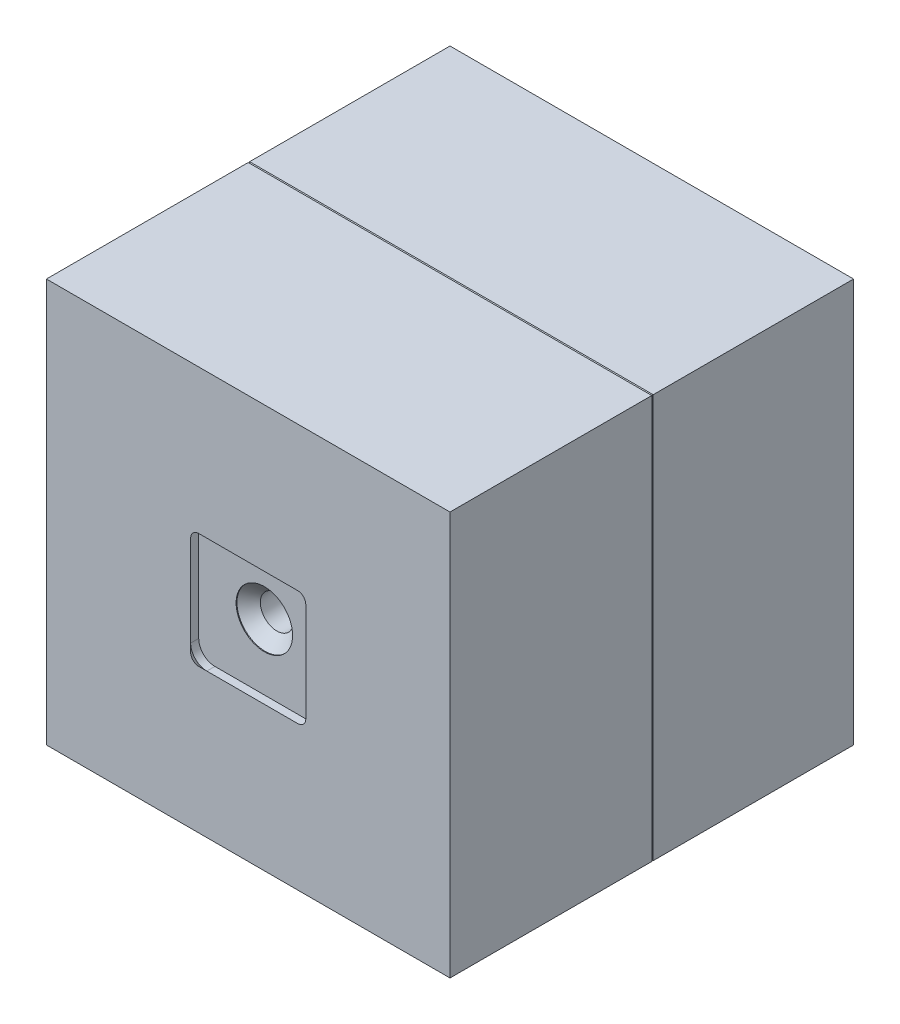
from build123d import *
from build123d.topology import SkipClean

# Parameters (mm, degrees)
SKETCH1_W            = 100
SKETCH1_H            = 100
BOSS_EXTRUDE1_DEPTH  = 50
SKETCH2_W            = 12.1
SKETCH2_H            = 12.1
CUT_EXTRUDE1_DEPTH   = 6.05
CAVITY1_START        = -48
CAVITY1_DEPTH        = 2
CAVITY1_START_2      = 46
CAVITY1_3_DEPTH      = 2
SKETCH5_R            = 2.5
CUT_EXTRUDE2_DEPTH   = 123.474487221
CHAMFER1_SIZE        = 0.35
SKETCH6_OUTSIDE_W    = 136.642
SKETCH6_OUTSIDE_H    = 136.642
CUT_EXTRUDE3_DEPTH   = 2
SKETCH7_OUTSIDE_W    = 136.642
SKETCH7_OUTSIDE_H    = 136.642
SKETCH7_OUTSIDE_W_2  = 96
SKETCH7_OUTSIDE_H_2  = 96
CUT_EXTRUDE4_DEPTH   = 121.847010801
SKETCH8_W            = 92
SKETCH8_H            = 92
SKETCH8_W_2          = 88
SKETCH8_H_2          = 88
CUT_EXTRUDE5_DEPTH   = 121.847010801
SKETCH9_R            = 1.5
CUT_EXTRUDE6_DEPTH   = 2
CIRPATTERN1_COUNT    = 4
SKETCH11_OUTSIDE_W   = 136.642
SKETCH11_OUTSIDE_H   = 136.642
SKETCH11_OUTSIDE_W_2 = 88
SKETCH11_OUTSIDE_H_2 = 88
CUT_EXTRUDE7_DEPTH   = 2
BOSS_EXTRUDE2_DEPTH  = 46
CIRPATTERN2_COUNT    = 4
FILLET1_R            = 1
FILLET2_START        = 2
FILLET2_DEPTH        = 46
SKETCH13_W           = 12.1
SKETCH13_H           = 12.1
SKETCH13_R           = 2.5
BOSS_EXTRUDE3_DEPTH  = 6.05
BOSS_EXTRUDE4_DEPTH  = 2
CUT_EXTRUDE10_DEPTH  = 2.5
CUT_SWEEP1_PITCH     = 2.5
CUT_SWEEP1_FROM      = 4
CHAMFER3_SIZE2       = 1.5
CHAMFER3_SIZE        = 2
CHAMFER4_SIZE2       = 1.81635632
CHAMFER4_SIZE        = 2.5
CUT_EXTRUDE11_DEPTH  = 44
CIRPATTERN3_COUNT    = 4
SKETCH22_R           = 4.1
CUT_EXTRUDE12_DEPTH  = 4.5
SKETCH24_W           = 100
SKETCH24_H           = 100
BOSS_EXTRUDE5_DEPTH  = 2
SKETCH25_W           = 100
SKETCH25_H           = 100
SKETCH25_W_2         = 88
SKETCH25_H_2         = 88
BOSS_EXTRUDE6_DEPTH  = 48


with BuildPart() as part:
    # Sketch1 → Boss-Extrude1 (new, symmetric)
    with BuildSketch(Plane.XY):
        Rectangle(SKETCH1_W, SKETCH1_H)
    extrude(amount=BOSS_EXTRUDE1_DEPTH, both=True)

    # Sketch2 → Cut-Extrude1 (cut, symmetric)
    with BuildSketch(Plane(origin=(0, 0, 0), x_dir=(1, 0, 0), z_dir=(0, 1, 0))):
        Rectangle(SKETCH2_W, SKETCH2_H)
    extrude(amount=CUT_EXTRUDE1_DEPTH, both=True, mode=Mode.SUBTRACT)


with BuildPart() as body_2:
    # Split1: read off the stored shape, not the designer's step
    # Split1: the piece on the far side of the plane
    add(part.part)
    split(bisect_by=Plane.XY, keep=Keep.BOTTOM)

    # Cavity1: read off the stored shape, not the designer's step
    # Cavity1 outline → Cavity1 (cut)
    with BuildSketch(Plane.XY.offset(CAVITY1_START)):
        with BuildLine():
            Line((16.263455967, -12.263455967), (16.263455967, 12.263455967))
            ThreePointArc((16.263455967, 12.263455967), (15.091883092, 15.091883092), (12.263455967, 16.263455967))
            Line((12.263455967, 16.263455967), (-12.263455967, 16.263455967))
            ThreePointArc((-12.263455967, 16.263455967), (-15.091883092, 15.091883092), (-16.263455967, 12.263455967))
            Line((-16.263455967, 12.263455967), (-16.263455967, -12.263455967))
            ThreePointArc((-16.263455967, -12.263455967), (-15.091883092, -15.091883092), (-12.263455967, -16.263455967))
            Line((-12.263455967, -16.263455967), (12.263455967, -16.263455967))
            ThreePointArc((12.263455967, -16.263455967), (15.091883092, -15.091883092), (16.263455967, -12.263455967))
        make_face()
    extrude(amount=CAVITY1_DEPTH, mode=Mode.SUBTRACT)

    # Cavity1 2: loft between two sections, ruled curve by curve
    cavity1_2_from = [
        Edge.make_three_point_arc((14.263455967, 12.263455967, -50), (13.67766953, 13.67766953, -50), (12.263455967, 14.263455967, -50)),
        Edge.make_three_point_arc((-12.263455967, 14.263455967, -50), (-13.67766953, 13.67766953, -50), (-14.263455967, 12.263455967, -50)),
        Edge.make_three_point_arc((12.263455967, -14.263455967, -50), (13.67766953, -13.67766953, -50), (14.263455967, -12.263455967, -50)),
        Edge.make_three_point_arc((-14.263455967, -12.263455967, -50), (-13.67766953, -13.67766953, -50), (-12.263455967, -14.263455967, -50)),
        Edge.make_line((-12.263455967, 14.263455967, -50), (12.263455967, 14.263455967, -50)),
        Edge.make_line((14.263455967, 12.263455967, -50), (14.263455967, -12.263455967, -50)),
        Edge.make_line((-14.263455967, 12.263455967, -50), (-14.263455967, -12.263455967, -50)),
        Edge.make_line((12.263455967, -14.263455967, -50), (-12.263455967, -14.263455967, -50)),
    ]
    cavity1_2_to = [
        Edge.make_three_point_arc((16.263455967, 12.263455967, -48), (15.091883092, 15.091883092, -48), (12.263455967, 16.263455967, -48)),
        Edge.make_three_point_arc((-12.263455967, 16.263455967, -48), (-15.091883092, 15.091883092, -48), (-16.263455967, 12.263455967, -48)),
        Edge.make_three_point_arc((12.263455967, -16.263455967, -48), (15.091883092, -15.091883092, -48), (16.263455967, -12.263455967, -48)),
        Edge.make_three_point_arc((-16.263455967, -12.263455967, -48), (-15.091883092, -15.091883092, -48), (-12.263455967, -16.263455967, -48)),
        Edge.make_line((-12.263455967, 16.263455967, -48), (12.263455967, 16.263455967, -48)),
        Edge.make_line((16.263455967, 12.263455967, -48), (16.263455967, -12.263455967, -48)),
        Edge.make_line((-16.263455967, 12.263455967, -48), (-16.263455967, -12.263455967, -48)),
        Edge.make_line((12.263455967, -16.263455967, -48), (-12.263455967, -16.263455967, -48)),
    ]
    cavity1_2 = Solid(Shell([*[Face.make_surface_from_curves(cavity1_2_from[k], cavity1_2_to[k]) for k in range(8)], Face(Wire(cavity1_2_from)), Face(Wire(cavity1_2_to))]))
    add(cavity1_2, mode=Mode.SUBTRACT)


with BuildPart() as part_1:
    add(part.part)

    # Split1
    split(bisect_by=Plane.XY, keep=Keep.TOP)

    # Cavity1 3 outline → Cavity1 3 (cut)
    with BuildSketch(Plane.XY.offset(CAVITY1_START_2)):
        with BuildLine():
            Line((-16.263455967, 12.263455967), (-16.263455967, -12.263455967))
            ThreePointArc((-16.263455967, -12.263455967), (-15.091883092, -15.091883092), (-12.263455967, -16.263455967))
            Line((-12.263455967, -16.263455967), (12.263455967, -16.263455967))
            ThreePointArc((12.263455967, -16.263455967), (15.091883092, -15.091883092), (16.263455967, -12.263455967))
            Line((16.263455967, -12.263455967), (16.263455967, 12.263455967))
            ThreePointArc((16.263455967, 12.263455967), (15.091883092, 15.091883092), (12.263455967, 16.263455967))
            Line((12.263455967, 16.263455967), (-12.263455967, 16.263455967))
            ThreePointArc((-12.263455967, 16.263455967), (-15.091883092, 15.091883092), (-16.263455967, 12.263455967))
        make_face()
    extrude(amount=CAVITY1_3_DEPTH, mode=Mode.SUBTRACT)

    # Cavity1 4: loft between two sections, ruled curve by curve
    cavity1_4_from = [
        Edge.make_three_point_arc((-14.263455967, 12.263455967, 50), (-13.67766953, 13.67766953, 50), (-12.263455967, 14.263455967, 50)),
        Edge.make_three_point_arc((12.263455967, 14.263455967, 50), (13.67766953, 13.67766953, 50), (14.263455967, 12.263455967, 50)),
        Edge.make_three_point_arc((-12.263455967, -14.263455967, 50), (-13.67766953, -13.67766953, 50), (-14.263455967, -12.263455967, 50)),
        Edge.make_three_point_arc((14.263455967, -12.263455967, 50), (13.67766953, -13.67766953, 50), (12.263455967, -14.263455967, 50)),
        Edge.make_line((12.263455967, 14.263455967, 50), (-12.263455967, 14.263455967, 50)),
        Edge.make_line((-14.263455967, 12.263455967, 50), (-14.263455967, -12.263455967, 50)),
        Edge.make_line((14.263455967, 12.263455967, 50), (14.263455967, -12.263455967, 50)),
        Edge.make_line((-12.263455967, -14.263455967, 50), (12.263455967, -14.263455967, 50)),
    ]
    cavity1_4_to = [
        Edge.make_three_point_arc((-16.263455967, 12.263455967, 48), (-15.091883092, 15.091883092, 48), (-12.263455967, 16.263455967, 48)),
        Edge.make_three_point_arc((12.263455967, 16.263455967, 48), (15.091883092, 15.091883092, 48), (16.263455967, 12.263455967, 48)),
        Edge.make_three_point_arc((-12.263455967, -16.263455967, 48), (-15.091883092, -15.091883092, 48), (-16.263455967, -12.263455967, 48)),
        Edge.make_three_point_arc((16.263455967, -12.263455967, 48), (15.091883092, -15.091883092, 48), (12.263455967, -16.263455967, 48)),
        Edge.make_line((12.263455967, 16.263455967, 48), (-12.263455967, 16.263455967, 48)),
        Edge.make_line((-16.263455967, 12.263455967, 48), (-16.263455967, -12.263455967, 48)),
        Edge.make_line((16.263455967, 12.263455967, 48), (16.263455967, -12.263455967, 48)),
        Edge.make_line((-12.263455967, -16.263455967, 48), (12.263455967, -16.263455967, 48)),
    ]
    cavity1_4 = Solid(Shell([*[Face.make_surface_from_curves(cavity1_4_from[k], cavity1_4_to[k]) for k in range(8)], Face(Wire(cavity1_4_from)), Face(Wire(cavity1_4_to))]))
    add(cavity1_4, mode=Mode.SUBTRACT)


with BuildPart() as cut_extrude2_tool:
    # Sketch5 → Cut-Extrude2 (new, through all)
    with BuildSketch(Plane.XY.offset(50)):
        with Locations(Location((0, 0, 0), (0, 0, 180))):
            Circle(SKETCH5_R)
    extrude(amount=-CUT_EXTRUDE2_DEPTH)


with BuildPart() as part_2:
    add(part_1.part)

    # Cut-Extrude2: cut by cut_extrude2_tool
    add(cut_extrude2_tool.part, mode=Mode.SUBTRACT)

    # Sketch6 outside → Cut-Extrude3 (cut)
    with BuildSketch(Plane.XY.offset(50)):
        Rectangle(SKETCH6_OUTSIDE_W, SKETCH6_OUTSIDE_H)
        with BuildLine():
            Line((-12.263455967, -18.263455967), (12.263455967, -18.263455967))
            ThreePointArc((12.263455967, -18.263455967), (16.506096654, -16.506096654), (18.263455967, -12.263455967))
            Line((18.263455967, -12.263455967), (18.263455967, 12.263455967))
            ThreePointArc((18.263455967, 12.263455967), (16.506096654, 16.506096654), (12.263455967, 18.263455967))
            Line((12.263455967, 18.263455967), (-12.263455967, 18.263455967))
            ThreePointArc((-12.263455967, 18.263455967), (-16.506096654, 16.506096654), (-18.263455967, 12.263455967))
            Line((-18.263455967, 12.263455967), (-18.263455967, -12.263455967))
            ThreePointArc((-18.263455967, -12.263455967), (-16.506096654, -16.506096654), (-12.263455967, -18.263455967))
        make_face(mode=Mode.SUBTRACT)
    extrude(amount=-CUT_EXTRUDE3_DEPTH, mode=Mode.SUBTRACT)

    # Sketch7 outside → Cut-Extrude4 (cut, through all)
    with BuildSketch(Plane.XY.offset(48)):
        Rectangle(SKETCH7_OUTSIDE_W, SKETCH7_OUTSIDE_H)
        Rectangle(SKETCH7_OUTSIDE_W_2, SKETCH7_OUTSIDE_H_2, mode=Mode.SUBTRACT)
    extrude(amount=-CUT_EXTRUDE4_DEPTH, mode=Mode.SUBTRACT)

    # Sketch8 → Cut-Extrude5 (cut, through all)
    with BuildSketch(Plane.XY.offset(48)):
        Rectangle(SKETCH8_W, SKETCH8_H)
        Rectangle(SKETCH8_W_2, SKETCH8_H_2, mode=Mode.SUBTRACT)
    extrude(amount=-CUT_EXTRUDE5_DEPTH, mode=Mode.SUBTRACT)


with BuildPart() as body_2_1:
    add(body_2.part)

    # Cut-Extrude2: cut by cut_extrude2_tool
    add(cut_extrude2_tool.part, mode=Mode.SUBTRACT)

    # Chamfer1
    chamfer1_edges = [body_2_1.edges().sort_by_distance(p)[0] for p in [
        (-50, 0, 0),
        (0, -50, 0),
        (50, 0, 0),
        (0, 50, 0),
    ]]
    chamfer(chamfer1_edges, length=CHAMFER1_SIZE)


with BuildPart() as cut_extrude5_piece_1:
    # of the separate pieces the step leaves, piece 1, a body of its own (cut_extrude5_pieces)
    add(part_2.part.solids().sort_by_distance((-44, -44, 48))[0])



with BuildPart() as cut_extrude5_piece_2:
    # of the separate pieces the step leaves, piece 2, a body of its own (cut_extrude5_pieces)
    add(part_2.part.solids().sort_by_distance((48, 48, 48))[0])

    # Sketch9 → Cut-Extrude6 (cut)
    with BuildSketch(Plane(origin=(0, 48, 0), x_dir=(1, 0, 0), z_dir=(0, 1, 0))):
        with Locations(Location((-42.5, -44.5, 0), (0, 0, 180))):
            Circle(SKETCH9_R)
        with Locations(Location((-42.5, -39.5, 0), (0, 0, 180))):
            Circle(SKETCH9_R)
        with Locations(Location((-42.5, -34.5, 0), (0, 0, 180))):
            Circle(SKETCH9_R)
        with Locations(Location((-42.5, -29.5, 0), (0, 0, 180))):
            Circle(SKETCH9_R)
        with Locations(Location((-37.5, -44.5, 0), (0, 0, 180))):
            Circle(SKETCH9_R)
        with Locations(Location((-37.5, -39.5, 0), (0, 0, 180))):
            Circle(SKETCH9_R)
        with Locations(Location((-37.5, -34.5, 0), (0, 0, 180))):
            Circle(SKETCH9_R)
        with Locations(Location((-37.5, -29.5, 0), (0, 0, 180))):
            Circle(SKETCH9_R)
        with Locations(Location((-32.5, -44.5, 0), (0, 0, 180))):
            Circle(SKETCH9_R)
        with Locations(Location((-32.5, -39.5, 0), (0, 0, 180))):
            Circle(SKETCH9_R)
        with Locations(Location((-32.5, -34.5, 0), (0, 0, 180))):
            Circle(SKETCH9_R)
        with Locations(Location((-32.5, -29.5, 0), (0, 0, 180))):
            Circle(SKETCH9_R)
        with Locations(Location((-27.5, -44.5, 0), (0, 0, 180))):
            Circle(SKETCH9_R)
        with Locations(Location((-27.5, -39.5, 0), (0, 0, 180))):
            Circle(SKETCH9_R)
        with Locations(Location((-27.5, -34.5, 0), (0, 0, 180))):
            Circle(SKETCH9_R)
        with Locations(Location((-27.5, -29.5, 0), (0, 0, 180))):
            Circle(SKETCH9_R)
        with Locations(Location((-22.5, -44.5, 0), (0, 0, 180))):
            Circle(SKETCH9_R)
        with Locations(Location((-22.5, -39.5, 0), (0, 0, 180))):
            Circle(SKETCH9_R)
        with Locations(Location((-22.5, -34.5, 0), (0, 0, 180))):
            Circle(SKETCH9_R)
        with Locations(Location((-22.5, -29.5, 0), (0, 0, 180))):
            Circle(SKETCH9_R)
        with Locations(Location((-17.5, -44.5, 0), (0, 0, 180))):
            Circle(SKETCH9_R)
        with Locations(Location((-17.5, -39.5, 0), (0, 0, 180))):
            Circle(SKETCH9_R)
        with Locations(Location((-17.5, -34.5, 0), (0, 0, 180))):
            Circle(SKETCH9_R)
        with Locations(Location((-17.5, -29.5, 0), (0, 0, 180))):
            Circle(SKETCH9_R)
        with Locations(Location((-12.5, -44.5, 0), (0, 0, 180))):
            Circle(SKETCH9_R)
        with Locations(Location((-12.5, -39.5, 0), (0, 0, 180))):
            Circle(SKETCH9_R)
        with Locations(Location((-12.5, -34.5, 0), (0, 0, 180))):
            Circle(SKETCH9_R)
        with Locations(Location((-12.5, -29.5, 0), (0, 0, 180))):
            Circle(SKETCH9_R)
        with Locations(Location((-7.5, -44.5, 0), (0, 0, 180))):
            Circle(SKETCH9_R)
        with Locations(Location((-7.5, -39.5, 0), (0, 0, 180))):
            Circle(SKETCH9_R)
        with Locations(Location((-7.5, -34.5, 0), (0, 0, 180))):
            Circle(SKETCH9_R)
        with Locations(Location((-7.5, -29.5, 0), (0, 0, 180))):
            Circle(SKETCH9_R)
    cut_extrude6 = extrude(amount=-CUT_EXTRUDE6_DEPTH, mode=Mode.SUBTRACT)

    # CirPattern1: Cut-Extrude6 ×4 about axis
    cirpattern1_axis = Axis((0, 0, -50), (0, 0, 1))
    for i in range(1, CIRPATTERN1_COUNT):
        add(cut_extrude6.rotate(cirpattern1_axis, i * 360 / CIRPATTERN1_COUNT), mode=Mode.SUBTRACT)

    # Sketch11 outside → Cut-Extrude7 (cut)
    with BuildSketch(Plane(origin=(0, 0, 0), x_dir=(-1, 0, 0), z_dir=(0, 0, -1))):
        Rectangle(SKETCH11_OUTSIDE_W, SKETCH11_OUTSIDE_H)
        Rectangle(SKETCH11_OUTSIDE_W_2, SKETCH11_OUTSIDE_H_2, mode=Mode.SUBTRACT)
    extrude(amount=-CUT_EXTRUDE7_DEPTH, mode=Mode.SUBTRACT)


with BuildPart() as cut_extrude5_piece_1_1:
    add(cut_extrude5_piece_1.part)

    add(cut_extrude5_piece_2.part)  # Boss-Extrude2 merges Cut-Extrude5 piece 2
    # Sketch10 → Boss-Extrude2 (add)
    with BuildSketch(Plane.XY.offset(48)):
        Polygon((42.232233047, 44), (45.767766953, 47.535533906), (47.535533906, 45.767766953), (44, 42.232233047), align=None)
    boss_extrude2 = extrude(amount=-BOSS_EXTRUDE2_DEPTH)

    # CirPattern2: Boss-Extrude2 ×4 about axis
    cirpattern2_axis = Axis((0, 0, 0), (0, 0, 1))
    for i in range(1, CIRPATTERN2_COUNT):
        add(boss_extrude2.rotate(cirpattern2_axis, i * 360 / CIRPATTERN2_COUNT))

    # Fillet1
    # the kernel refuses this fillet: 1 mm, written as the material it adds along each edge
    with BuildSketch(Plane(origin=(-44.232233047, 46, 2), x_dir=(1, 0, 0), z_dir=(0, 0, 1))) as fillet1_piece_1_section:
        with BuildLine():
            CenterArc((FILLET1_R * 2.41421356237, -FILLET1_R), FILLET1_R, 90, 135)
            Line((FILLET1_R * 1.70710678119, -FILLET1_R * 1.70710678119), (0, 0))
            Line((0, 0), (FILLET1_R * 2.41421356237, 0))
        make_face()
    fillet1_piece_1 = extrude(amount=46, mode=Mode.PRIVATE)
    fillet1_piece_1 = fillet1_piece_1 - Plane(origin=(-42.5, 46, 29.5), x_dir=(-1, 0, 0), z_dir=(0, 1, 0)) * Cylinder(1.5, 102, mode=Mode.PRIVATE)
    fillet1_piece_1 = fillet1_piece_1 - Plane(origin=(-42.5, 46, 34.5), x_dir=(-1, 0, 0), z_dir=(0, 1, 0)) * Cylinder(1.5, 102, mode=Mode.PRIVATE)
    fillet1_piece_1 = fillet1_piece_1 - Plane(origin=(-42.5, 46, 39.5), x_dir=(-1, 0, 0), z_dir=(0, 1, 0)) * Cylinder(1.5, 102, mode=Mode.PRIVATE)
    fillet1_piece_1 = fillet1_piece_1 - Plane(origin=(-42.5, 46, 44.5), x_dir=(-1, 0, 0), z_dir=(0, 1, 0)) * Cylinder(1.5, 102, mode=Mode.PRIVATE)
    add(fillet1_piece_1)
    with BuildSketch(Plane(origin=(-46, 44.232233047, 48), x_dir=(0, -1, 0), z_dir=(0, 0, -1)), Plane(origin=(-44.232233047, -46, 48), x_dir=(1, 0, 0), z_dir=(0, 0, -1)), Plane(origin=(46, -44.232233047, 48), x_dir=(0, 1, 0), z_dir=(0, 0, -1)), Plane(origin=(44.232233047, 46, 48), x_dir=(-1, 0, 0), z_dir=(0, 0, -1))) as fillet1_piece_2:
        with BuildLine():
            CenterArc((FILLET1_R * 2.41421356237, -FILLET1_R), FILLET1_R, 90, 135)
            Line((FILLET1_R * 1.70710678119, -FILLET1_R * 1.70710678119), (0, 0))
            Line((0, 0), (FILLET1_R * 2.41421356237, 0))
        make_face()
    extrude(amount=46)
    with BuildSketch(Plane(origin=(-46, -44.232233047, 2), x_dir=(0, 1, 0), z_dir=(0, 0, 1))) as fillet1_piece_3_section:
        with BuildLine():
            CenterArc((FILLET1_R * 2.41421356237, -FILLET1_R), FILLET1_R, 90, 135)
            Line((FILLET1_R * 1.70710678119, -FILLET1_R * 1.70710678119), (0, 0))
            Line((0, 0), (FILLET1_R * 2.41421356237, 0))
        make_face()
    fillet1_piece_3 = extrude(amount=46, mode=Mode.PRIVATE)
    fillet1_piece_3 = fillet1_piece_3 - Plane(origin=(-46, -42.5, 29.5), x_dir=(0, -1, 0), z_dir=(-1, 0, 0)) * Cylinder(1.5, 102, mode=Mode.PRIVATE)
    fillet1_piece_3 = fillet1_piece_3 - Plane(origin=(-46, -42.5, 34.5), x_dir=(0, -1, 0), z_dir=(-1, 0, 0)) * Cylinder(1.5, 102, mode=Mode.PRIVATE)
    fillet1_piece_3 = fillet1_piece_3 - Plane(origin=(-46, -42.5, 39.5), x_dir=(0, -1, 0), z_dir=(-1, 0, 0)) * Cylinder(1.5, 102, mode=Mode.PRIVATE)
    fillet1_piece_3 = fillet1_piece_3 - Plane(origin=(-46, -42.5, 44.5), x_dir=(0, -1, 0), z_dir=(-1, 0, 0)) * Cylinder(1.5, 102, mode=Mode.PRIVATE)
    add(fillet1_piece_3)
    with BuildSketch(Plane(origin=(44.232233047, -46, 2), x_dir=(-1, 0, 0), z_dir=(0, 0, 1))) as fillet1_piece_4_section:
        with BuildLine():
            CenterArc((FILLET1_R * 2.41421356237, -FILLET1_R), FILLET1_R, 90, 135)
            Line((FILLET1_R * 1.70710678119, -FILLET1_R * 1.70710678119), (0, 0))
            Line((0, 0), (FILLET1_R * 2.41421356237, 0))
        make_face()
    fillet1_piece_4 = extrude(amount=46, mode=Mode.PRIVATE)
    fillet1_piece_4 = fillet1_piece_4 - Plane(origin=(42.5, -46, 29.5), x_dir=(1, 0, 0), z_dir=(0, -1, 0)) * Cylinder(1.5, 102, mode=Mode.PRIVATE)
    fillet1_piece_4 = fillet1_piece_4 - Plane(origin=(42.5, -46, 34.5), x_dir=(1, 0, 0), z_dir=(0, -1, 0)) * Cylinder(1.5, 102, mode=Mode.PRIVATE)
    fillet1_piece_4 = fillet1_piece_4 - Plane(origin=(42.5, -46, 39.5), x_dir=(1, 0, 0), z_dir=(0, -1, 0)) * Cylinder(1.5, 102, mode=Mode.PRIVATE)
    fillet1_piece_4 = fillet1_piece_4 - Plane(origin=(42.5, -46, 44.5), x_dir=(1, 0, 0), z_dir=(0, -1, 0)) * Cylinder(1.5, 102, mode=Mode.PRIVATE)
    add(fillet1_piece_4)
    with BuildSketch(Plane(origin=(46, 44.232233047, 2), x_dir=(0, -1, 0), z_dir=(0, 0, 1))) as fillet1_piece_5_section:
        with BuildLine():
            CenterArc((FILLET1_R * 2.41421356237, -FILLET1_R), FILLET1_R, 90, 135)
            Line((FILLET1_R * 1.70710678119, -FILLET1_R * 1.70710678119), (0, 0))
            Line((0, 0), (FILLET1_R * 2.41421356237, 0))
        make_face()
    fillet1_piece_5 = extrude(amount=46, mode=Mode.PRIVATE)
    fillet1_piece_5 = fillet1_piece_5 - Plane(origin=(46, 42.5, 29.5), x_dir=(0, 1, 0), z_dir=(1, 0, 0)) * Cylinder(1.5, 102, mode=Mode.PRIVATE)
    fillet1_piece_5 = fillet1_piece_5 - Plane(origin=(46, 42.5, 34.5), x_dir=(0, 1, 0), z_dir=(1, 0, 0)) * Cylinder(1.5, 102, mode=Mode.PRIVATE)
    fillet1_piece_5 = fillet1_piece_5 - Plane(origin=(46, 42.5, 39.5), x_dir=(0, 1, 0), z_dir=(1, 0, 0)) * Cylinder(1.5, 102, mode=Mode.PRIVATE)
    fillet1_piece_5 = fillet1_piece_5 - Plane(origin=(46, 42.5, 44.5), x_dir=(0, 1, 0), z_dir=(1, 0, 0)) * Cylinder(1.5, 102, mode=Mode.PRIVATE)
    add(fillet1_piece_5)

    # Fillet2: read off the stored shape, not the designer's step
    # Fillet2 outline → Fillet2 (add)
    with BuildSketch(Plane.XY.offset(FILLET2_START)):
        with BuildLine():
            Line((44, 42.232233047), (44, 41.818019485))
            ThreePointArc((44, 41.818019485), (44.076120467, 42.200702917), (44.292893219, 42.525126266))
            Line((44.292893219, 42.525126266), (44, 42.232233047))
        make_face()
        with BuildLine():
            ThreePointArc((44.292893219, -42.525126266), (44.076120467, -42.200702917), (44, -41.818019485))
            Line((44, -41.818019485), (44, -42.232233047))
            Line((44, -42.232233047), (44.292893219, -42.525126266))
        make_face()
        with BuildLine():
            Line((41.818019485, 44), (42.232233047, 44))
            Line((42.232233047, 44), (42.525126266, 44.292893219))
            ThreePointArc((42.525126266, 44.292893219), (42.200702917, 44.076120467), (41.818019485, 44))
        make_face()
        with BuildLine():
            Line((42.525126266, -44.292893219), (42.232233047, -44))
            Line((42.232233047, -44), (41.818019485, -44))
            ThreePointArc((41.818019485, -44), (42.200702917, -44.076120467), (42.525126266, -44.292893219))
        make_face()
        with BuildLine():
            Line((-42.232233047, 44), (-41.818019485, 44))
            ThreePointArc((-41.818019485, 44), (-42.200702917, 44.076120467), (-42.525126266, 44.292893219))
            Line((-42.525126266, 44.292893219), (-42.232233047, 44))
        make_face()
        with BuildLine():
            ThreePointArc((-42.525126266, -44.292893219), (-42.200702917, -44.076120467), (-41.818019485, -44))
            Line((-41.818019485, -44), (-42.232233047, -44))
            Line((-42.232233047, -44), (-42.525126266, -44.292893219))
        make_face()
        with BuildLine():
            Line((-44, 41.818019485), (-44, 42.232233047))
            Line((-44, 42.232233047), (-44.292893219, 42.525126266))
            ThreePointArc((-44.292893219, 42.525126266), (-44.076120467, 42.200702917), (-44, 41.818019485))
        make_face()
        with BuildLine():
            Line((-44.292893219, -42.525126266), (-44, -42.232233047))
            Line((-44, -42.232233047), (-44, -41.818019485))
            ThreePointArc((-44, -41.818019485), (-44.076120467, -42.200702917), (-44.292893219, -42.525126266))
        make_face()
    extrude(amount=FILLET2_DEPTH)

    # Sketch13 → Boss-Extrude3 (add)
    with SkipClean():  # the faces are left unmerged after this step: merging them gives an invalid solid
        with BuildSketch(Plane(origin=(0, 0, 6.05), x_dir=(-1, 0, 0), z_dir=(0, 0, -1))):
            Rectangle(SKETCH13_W, SKETCH13_H)
            with Locations(Location((0, 0, 0), (0, 0, 180))):
                Circle(SKETCH13_R, mode=Mode.SUBTRACT)
        extrude(amount=BOSS_EXTRUDE3_DEPTH)

    # Sketch17 → Boss-Extrude4 (add)
    with SkipClean():  # the faces are left unmerged after this step: merging them gives an invalid solid
        with BuildSketch(Plane(origin=(0, 0, 0), x_dir=(-1, 0, 0), z_dir=(0, 0, -1))):
            with BuildLine():
                Line((0, 2.5), (0, 6.5))
                ThreePointArc((0, 6.5), (6.5, 0), (0, -6.5))
                Line((0, -6.5), (0, -2.5))
                ThreePointArc((0, -2.5), (2.5, 0), (0, 2.5))
            make_face()
        extrude(amount=BOSS_EXTRUDE4_DEPTH)

    # Sketch18 → Cut-Extrude10 (cut)
    with SkipClean():  # the faces are left unmerged after this step: merging them gives an invalid solid
        with BuildSketch(Plane(origin=(0, 0, 0), x_dir=(-1, 0, 0), z_dir=(0, 0, -1))):
            with BuildLine():
                Line((0, -6.5), (0, 6.5))
                ThreePointArc((0, 6.5), (-6.5, 0), (0, -6.5))
            make_face()
        extrude(amount=-CUT_EXTRUDE10_DEPTH, mode=Mode.SUBTRACT)

    # Cut-Sweep1: arcs per turn and ends read off the stored shape
    # Cut-Sweep1: the profile of Sketch20 profile screwed along a right-hand helix through 18 turns, 10 arcs to a turn; built about Z, then put on its axis
    with SkipClean():  # the faces are left unmerged after this step: merging them gives an invalid solid
        cut_sweep1_z = Axis((0, 0, 0), (0, 0, 1))
        cut_sweep1_corners = [(4.1, 0, 0.089015606), (2.4997, 0, 1.012949242), (2.4997, 0, -0.83491803)]
        with BuildLine(mode=Mode.PRIVATE) as cut_sweep1_profile:
            Line(cut_sweep1_corners[0], cut_sweep1_corners[1])
            Line(cut_sweep1_corners[1], cut_sweep1_corners[2])
            Line(cut_sweep1_corners[2], cut_sweep1_corners[0])
        cut_sweep1_cap = Face(cut_sweep1_profile.wire())
        cut_sweep1_turn_angles = [0, 18, 36, 54, 72, 90, 108, 126, 144, 162, 180, 198, 216, 234, 252, 270, 288, 306, 324, 342, 360]
        cut_sweep1_turn_weights = [1, 0.9510565162951535, 1, 0.9510565162951535, 1, 0.9510565162951535, 1, 0.9510565162951535, 1, 0.9510565162951535, 1, 0.9510565162951535, 1, 0.9510565162951535, 1, 0.9510565162951535, 1, 0.9510565162951535, 1, 0.9510565162951535, 1]
        cut_sweep1_turn_rails = [Edge.make_bspline([Vector(p[0], p[1], 0).rotate(cut_sweep1_z, cut_sweep1_turn_angles[k]) / cut_sweep1_turn_weights[k] + Vector(0, 0, p[2] + CUT_SWEEP1_PITCH * cut_sweep1_turn_angles[k] / 360) for k in range(21)], [0, 0, 0, 1, 1, 2, 2, 3, 3, 4, 4, 5, 5, 6, 6, 7, 7, 8, 8, 9, 9, 10, 10, 10], 2, cut_sweep1_turn_weights) for p in cut_sweep1_corners]
        cut_sweep1_turn_sides = [Face.make_surface_from_curves(cut_sweep1_turn_rails[p[0]], cut_sweep1_turn_rails[p[1]]) for p in [(0, 1), (1, 2), (2, 0)]]
        cut_sweep1 = Plane(origin=(0, 0, -6), x_dir=(0, 1, 0), z_dir=(0, 0, 1)) * split(Solid(Shell([*[p.moved(Location((0, 0, CUT_SWEEP1_PITCH * i))) for i in range(18) for p in cut_sweep1_turn_sides], cut_sweep1_cap, cut_sweep1_cap.rotate(cut_sweep1_z, 6480).moved(Location((0, 0, CUT_SWEEP1_PITCH * 6480 / 360)))])), bisect_by=Plane.XY.offset(CUT_SWEEP1_FROM), keep=Keep.TOP, mode=Mode.PRIVATE)
        add(cut_sweep1, mode=Mode.SUBTRACT)
    add(cut_extrude5_piece_1_1.part.scale(1), mode=Mode.REPLACE)  # the faces are merged on a copy

    # Chamfer3
    chamfer3_edges = [cut_extrude5_piece_1_1.edges().sort_by_distance(p)[0] for p in [
        (-6.5, 0, -2),
    ]]
    chamfer3_side = [cut_extrude5_piece_1_1.faces().sort_by_distance(p)[0] for p in [
        (-6.5, 0, -1.97),
    ]]
    chamfer(chamfer3_edges, length=CHAMFER3_SIZE - 0.0001, length2=CHAMFER3_SIZE2 - 0.0001, reference=chamfer3_side[0])  # a hair under: the kernel refuses the full size

    # Chamfer4
    chamfer4_edges = [cut_extrude5_piece_1_1.edges().sort_by_distance(p)[0] for p in [
        (6.5, 0, 2.5),
    ]]
    chamfer4_side = [cut_extrude5_piece_1_1.faces().sort_by_distance(p)[0] for p in [
        (6.5, 0, 2.463672874),
    ]]
    chamfer(chamfer4_edges, length=CHAMFER4_SIZE - 0.0001, length2=CHAMFER4_SIZE2 - 0.0001, reference=chamfer4_side[0])  # a hair under: the kernel refuses the full size

    # Sketch21 → Cut-Extrude11 (cut)
    with BuildSketch(Plane(origin=(0, 0, 0), x_dir=(-1, 0, 0), z_dir=(0, 0, -1))):
        with BuildLine():
            Line((0.5, 7.483314774), (0.5, 42))
            Line((0.5, 42), (42, 42))
            Line((42, 42), (42, 0.5))
            Line((42, 0.5), (7.483314774, 0.5))
            ThreePointArc((7.483314774, 0.5), (5.303300859, 5.303300859), (0.5, 7.483314774))
        make_face()
    cut_extrude11 = extrude(amount=-CUT_EXTRUDE11_DEPTH, mode=Mode.SUBTRACT)

    # CirPattern3: Cut-Extrude11 ×4 about axis
    cirpattern3_axis = Axis((0, 0, 0), (0, 0, 1))
    for i in range(1, CIRPATTERN3_COUNT):
        add(cut_extrude11.rotate(cirpattern3_axis, i * 360 / CIRPATTERN3_COUNT), mode=Mode.SUBTRACT)

    # Sketch22 → Cut-Extrude12 (cut)
    with BuildSketch(Plane(origin=(0, 0, -2), x_dir=(-1, 0, 0), z_dir=(0, 0, -1))):
        Circle(SKETCH22_R)
    extrude(amount=-CUT_EXTRUDE12_DEPTH, mode=Mode.SUBTRACT)

    # Sketch23 → Cut-Revolve1 (revolve, cut)
    with BuildSketch(Plane(origin=(0, 0, 0), x_dir=(1, 0, 0), z_dir=(0, 1, 0)), mode=Mode.PRIVATE) as cut_revolve1_sk:
        Polygon((0, -46), (-7, -46), (-7, -45.8), (-4.1, -42.9), (-4.1, -2.5), (0, -2.5), align=None)
    revolve(cut_revolve1_sk.sketch.rotate(Axis((0, 0, 46), (0, 0, -1)), 180), axis=Axis((0, 0, 46), (0, 0, -1)), mode=Mode.SUBTRACT)

    # Sketch24 → Boss-Extrude5 (add)
    with BuildSketch(Plane.XY.offset(50)):
        Rectangle(SKETCH24_W, SKETCH24_H)
        with BuildLine():
            Line((-18.263455967, 12.263455967), (-18.263455967, -12.263455967))
            ThreePointArc((-18.263455967, -12.263455967), (-16.506096654, -16.506096654), (-12.263455967, -18.263455967))
            Line((-12.263455967, -18.263455967), (12.263455967, -18.263455967))
            ThreePointArc((12.263455967, -18.263455967), (16.506096654, -16.506096654), (18.263455967, -12.263455967))
            Line((18.263455967, -12.263455967), (18.263455967, 12.263455967))
            ThreePointArc((18.263455967, 12.263455967), (16.506096654, 16.506096654), (12.263455967, 18.263455967))
            Line((12.263455967, 18.263455967), (-12.263455967, 18.263455967))
            ThreePointArc((-12.263455967, 18.263455967), (-16.506096654, 16.506096654), (-18.263455967, 12.263455967))
        make_face(mode=Mode.SUBTRACT)
    extrude(amount=-BOSS_EXTRUDE5_DEPTH)

    # Sketch25 → Boss-Extrude6 (add)
    with BuildSketch(Plane(origin=(0, 0, 0), x_dir=(-1, 0, 0), z_dir=(0, 0, -1))):
        Rectangle(SKETCH25_W, SKETCH25_H)
        Rectangle(SKETCH25_W_2, SKETCH25_H_2, mode=Mode.SUBTRACT)
    extrude(amount=-BOSS_EXTRUDE6_DEPTH)


solid = Compound([body_2_1.part, cut_extrude5_piece_1_1.part])
